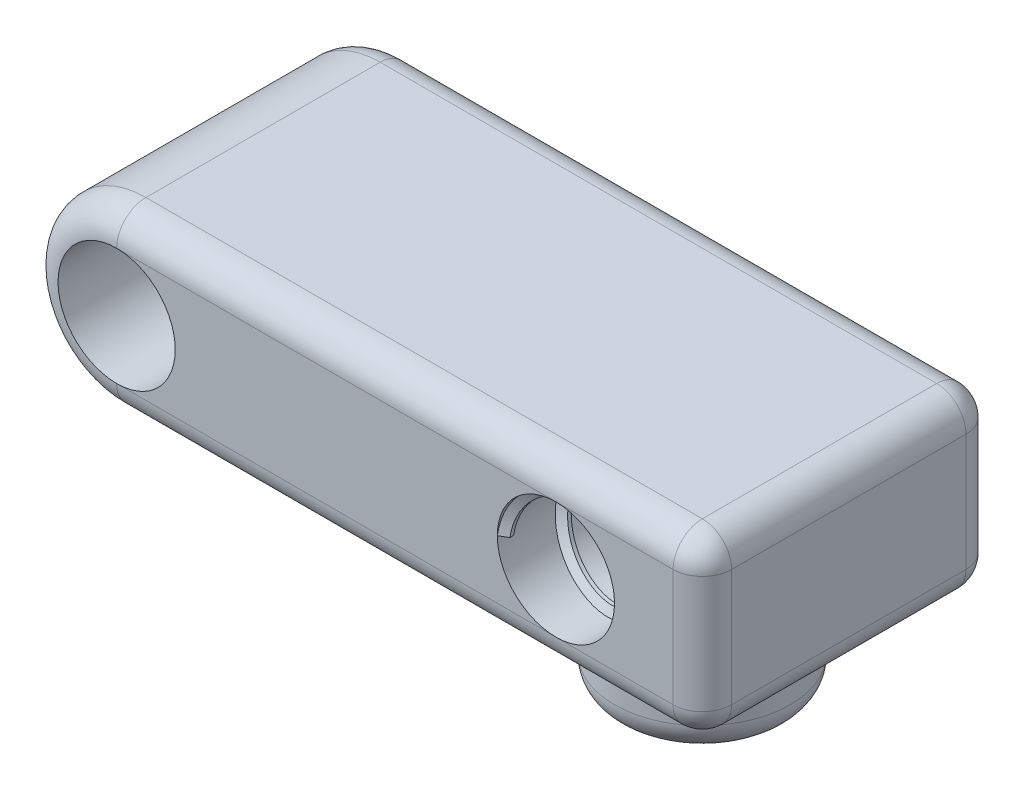
from build123d import *

# Parameters (mm, degrees)
SKETCH1_R                = 15
SKETCH1_R_2              = 10
BOSS_EXTRUDE1_DEPTH      = 50
BOSS_EXTRUDE2_DEPTH      = 15
BOSS_EXTRUDE2_DEPTH_BACK = 15
SKETCH2_W                = 100
SKETCH2_H                = 50
CUT_EXTRUDE1_DEPTH       = 113.805141727
CUT_EXTRUDE1_DEPTH_BACK  = 113.805141727
SKETCH3_R                = 10
SKETCH4_R                = 15
SKETCH4_R_2              = 10
BOSS_EXTRUDE3_DEPTH      = 15
FILLET1_R                = 5
FILLET2_R                = 5
FILLET3_R                = 5
FILLET4_R                = 5
FILLET5_R                = 5
SKETCH6_R                = 10
CUT_EXTRUDE2_DEPTH       = 52
THREAD1_PITCH            = 10
CUT_EXTRUDE3_DEPTH       = 52


with BuildPart() as part:
    # Sketch1 → Boss-Extrude1 (new body)
    with BuildSketch(Plane.XY):
        Circle(SKETCH1_R)
        Circle(SKETCH1_R_2, mode=Mode.SUBTRACT)
    extrude(amount=BOSS_EXTRUDE1_DEPTH)

    # Sketch2 → Boss-Extrude2 (add, two sides: drawn at the far end of the back side and taken through both)
    with BuildSketch(Plane(origin=(0, 0, 0), x_dir=(1, 0, 0), z_dir=(0, 1, 0)).offset(-BOSS_EXTRUDE2_DEPTH_BACK)):
        with Locations((50, -25)):
            Rectangle(SKETCH2_W, SKETCH2_H)
    extrude(amount=BOSS_EXTRUDE2_DEPTH + BOSS_EXTRUDE2_DEPTH_BACK)

    # Sketch3 → Cut-Extrude1 (cut, two sides: drawn at the far end of the back side and taken through both)
    with BuildSketch(Plane.XY.offset(50).offset(-CUT_EXTRUDE1_DEPTH_BACK)):
        Circle(SKETCH3_R)
    extrude(amount=CUT_EXTRUDE1_DEPTH + CUT_EXTRUDE1_DEPTH_BACK, mode=Mode.SUBTRACT)

    # Sketch4 → Boss-Extrude3 (add)
    with BuildSketch(Plane.XZ.offset(15)):
        with Locations(Location((75, 25, 0), (0, 0, 90))):
            Circle(SKETCH4_R)
        with Locations(Location((75, 25, 0), (0, 0, 270))):
            Circle(SKETCH4_R_2, mode=Mode.SUBTRACT)
    extrude(amount=BOSS_EXTRUDE3_DEPTH)

    # Fillet1
    fillet1_edges = [part.edges().sort_by_distance(p)[0] for p in [
        (75, -15, 10),
    ]]
    fillet(fillet1_edges, radius=FILLET1_R)

    # Fillet2
    fillet2_edges = [part.edges().sort_by_distance(p)[0] for p in [
        (100, 15, 25),
    ]]
    fillet(fillet2_edges, radius=FILLET2_R)

    # Fillet3
    fillet3_edges = [part.edges().sort_by_distance(p)[0] for p in [
        (100, -15, 25),
    ]]
    fillet(fillet3_edges, radius=FILLET3_R - 0.0001)  # a hair under: the kernel refuses the full size

    # Fillet4
    fillet4_edges = [part.edges().sort_by_distance(p)[0] for p in [
        (47.50005, -15, 50),
        (47.5, 15, 50),
        (-15, 0, 0),
        (-15, 0, 50),
        (47.5, 15, 0),
        (98.535533906, 13.535533906, 0),
        (98.535533906, 13.535533906, 50),
        (100, -5e-05, 0),
        (100, -5e-05, 50),
        (47.50005, -15, 0),
        (98.535563195, -13.535563195, 0),
        (98.535563195, -13.535563195, 50),
    ]]
    fillet(fillet4_edges, radius=FILLET4_R - 0.0001)  # a hair under: the kernel refuses the full size

    # Fillet5
    fillet5_edges = [part.edges().sort_by_distance(p)[0] for p in [
        (75, -30, 10),
    ]]
    fillet(fillet5_edges, radius=FILLET5_R - 0.0001)  # a hair under: the kernel refuses the full size

    # Sketch6 → Cut-Extrude2 (cut)
    with BuildSketch(Plane.XY.offset(50)):
        with Locations(Location((75, 0, 0), (0, 0, 270))):
            Circle(SKETCH6_R)
    extrude(amount=-CUT_EXTRUDE2_DEPTH, mode=Mode.SUBTRACT)

    # Thread1: the profile of Thread Profile1 profile screwed along a right-hand helix of 5 turns, 16 arcs to a turn; built about Z, then put on its axis
    thread1_z = Axis((0, 0, 0), (0, 0, 1))
    thread1_corners = [(10.0003, 0, -0.000173205), (10.0003, 0, 2.187673198), (8.646835313, 0, 1.406249997), (8.646835313, 0, 0.781249997)]
    with BuildLine(mode=Mode.PRIVATE) as thread1_profile:
        Line(thread1_corners[0], thread1_corners[1])
        Line(thread1_corners[1], thread1_corners[2])
        Line(thread1_corners[2], thread1_corners[3])
        Line(thread1_corners[3], thread1_corners[0])
    thread1_cap = Face(thread1_profile.wire())
    thread1_turn_angles = [0, 11.25, 22.5, 33.75, 45, 56.25, 67.5, 78.75, 90, 101.25, 112.5, 123.75, 135, 146.25, 157.5, 168.75, 180, 191.25, 202.5, 213.75, 225, 236.25, 247.5, 258.75, 270, 281.25, 292.5, 303.75, 315, 326.25, 337.5, 348.75, 360]
    thread1_turn_weights = [1, 0.9807852804032304, 1, 0.9807852804032304, 1, 0.9807852804032304, 1, 0.9807852804032304, 1, 0.9807852804032304, 1, 0.9807852804032304, 1, 0.9807852804032304, 1, 0.9807852804032304, 1, 0.9807852804032304, 1, 0.9807852804032304, 1, 0.9807852804032304, 1, 0.9807852804032304, 1, 0.9807852804032304, 1, 0.9807852804032304, 1, 0.9807852804032304, 1, 0.9807852804032304, 1]
    thread1_turn_rails = [Edge.make_bspline([Vector(p[0], p[1], 0).rotate(thread1_z, thread1_turn_angles[k]) / thread1_turn_weights[k] + Vector(0, 0, p[2] + THREAD1_PITCH * thread1_turn_angles[k] / 360) for k in range(33)], [0, 0, 0, 1, 1, 2, 2, 3, 3, 4, 4, 5, 5, 6, 6, 7, 7, 8, 8, 9, 9, 10, 10, 11, 11, 12, 12, 13, 13, 14, 14, 15, 15, 16, 16, 16], 2, thread1_turn_weights) for p in thread1_corners]
    thread1_turn_sides = [Face.make_surface_from_curves(thread1_turn_rails[p[0]], thread1_turn_rails[p[1]]) for p in [(0, 1), (1, 2), (2, 3), (3, 0)]]
    thread1 = Plane(origin=(75, 0, 50), x_dir=(-1, 0, 0), z_dir=(0, 0, -1)) * Solid(Shell([*[p.moved(Location((0, 0, THREAD1_PITCH * i))) for i in range(5) for p in thread1_turn_sides], thread1_cap, thread1_cap.rotate(thread1_z, 1800).moved(Location((0, 0, THREAD1_PITCH * 1800 / 360)))]))
    add(thread1)

    # Sketch9 → Cut-Extrude3 (cut)
    with BuildSketch(Plane(origin=(100, 0, 0), x_dir=(0, 0, -1), z_dir=(1, 0, 0))):
        Polygon((0, -10), (0, 14.965274405), (11.167086568, 14.965274405), (11.167086568, -16.38295289), (0, -16.38295289), align=None)
    extrude(amount=-CUT_EXTRUDE3_DEPTH, mode=Mode.SUBTRACT)


solid = part.part
